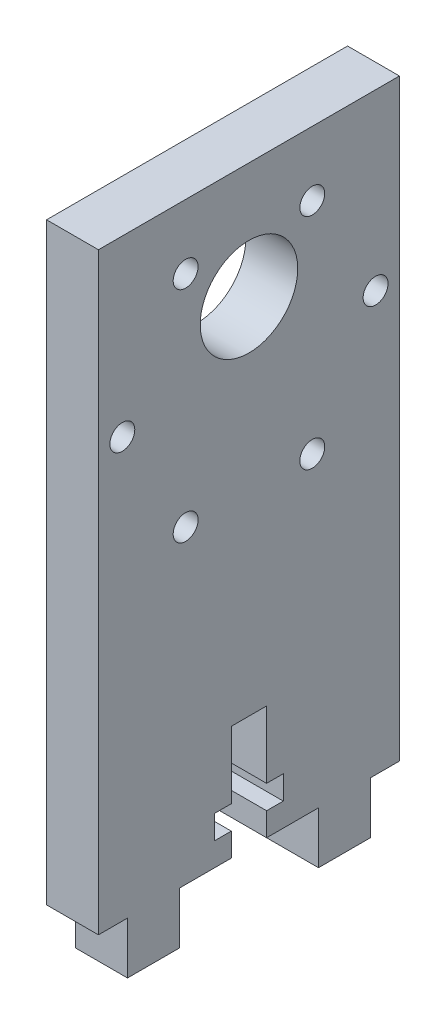
from build123d import *

# Parameters (mm, degrees)
MOTOR_PLATE_R       = 1.524
MOTOR_PLATE_R_2     = 5.969
BOSS_EXTRUDE1_DEPTH = 6.35


with BuildPart() as part:
    # Motor plate → Boss-Extrude1 (new body)
    with BuildSketch(Plane(origin=(0, 0, 0), x_dir=(0, 0, -1), z_dir=(1, 0, 0))):
        Polygon((-18.415, 36.300098803), (-18.415, -36.300098803), (-14.859, -36.300098803), (-14.859, -42.650098803), (-8.509, -42.650098803), (-8.509, -36.300098803), (-2.159, -36.300098803), (-2.159, -33.432395821), (-4.199999982, -33.432395821), (-4.199999982, -30.532395779), (-2.159, -30.532395779), (-2.159, -22.330098803), (2.159, -22.330098803), (2.159, -30.532395779), (4.199999982, -30.532395779), (4.199999982, -33.432395821), (2.159, -33.432395821), (2.159, -36.300098803), (8.509, -36.300098803), (8.509, -42.650098803), (14.859, -42.650098803), (14.859, -36.300098803), (18.415, -36.300098803), (18.415, 36.300098803), align=None)
        with Locations((-15.494, 15.007901197)):
            Circle(MOTOR_PLATE_R, mode=Mode.SUBTRACT)
        with Locations((-7.747, 1.589703591)):
            Circle(MOTOR_PLATE_R, mode=Mode.SUBTRACT)
        with Locations((0, 22.119901197)):
            Circle(MOTOR_PLATE_R_2, mode=Mode.SUBTRACT)
        with Locations((-7.747, 28.426098803)):
            Circle(MOTOR_PLATE_R, mode=Mode.SUBTRACT)
        with Locations((7.747, 1.589703591)):
            Circle(MOTOR_PLATE_R, mode=Mode.SUBTRACT)
        with Locations((15.494, 15.007901197)):
            Circle(MOTOR_PLATE_R, mode=Mode.SUBTRACT)
        with Locations((7.747, 28.426098803)):
            Circle(MOTOR_PLATE_R, mode=Mode.SUBTRACT)
    extrude(amount=BOSS_EXTRUDE1_DEPTH)


solid = part.part
